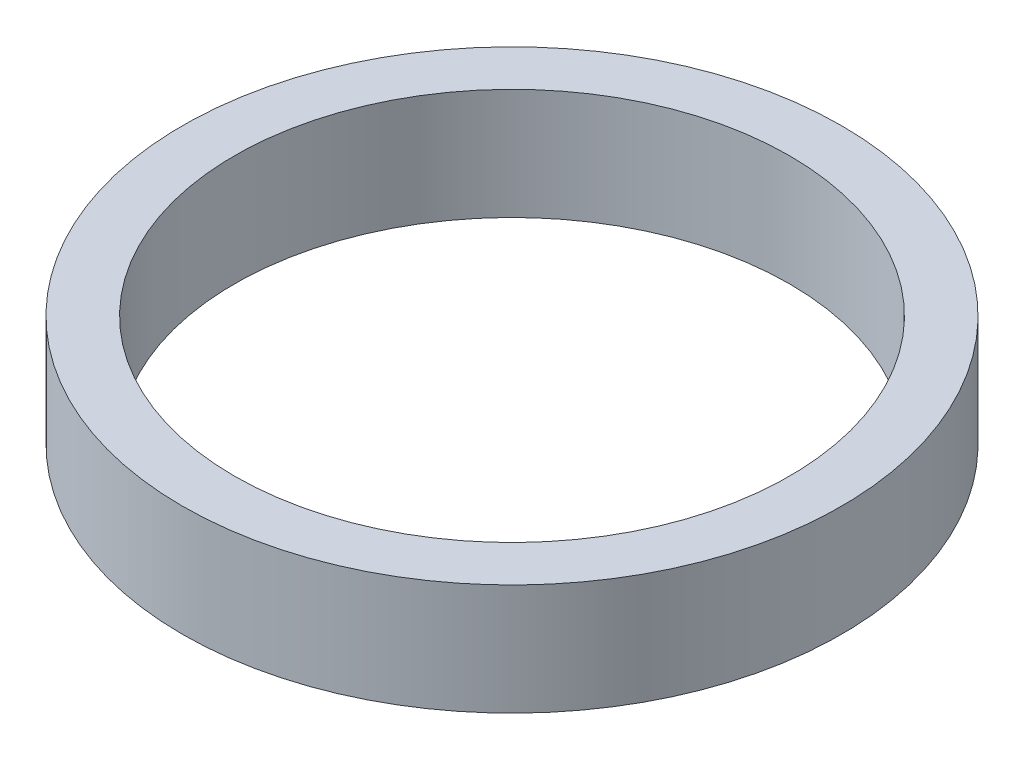
from build123d import *

# Parameters (mm, degrees)
SKETCH1_R           = 47.5
BOSS_EXTRUDE1_DEPTH = 16
SKETCH2_R           = 40
CUT_EXTRUDE1_DEPTH  = 70.054326439


with BuildPart() as part:
    # Sketch1 → Boss-Extrude1 (new body)
    with BuildSketch(Plane(origin=(0, 0, 0), x_dir=(1, 0, 0), z_dir=(0, 1, 0))):
        Circle(SKETCH1_R)
    extrude(amount=BOSS_EXTRUDE1_DEPTH)

    # Sketch2 → Cut-Extrude1 (cut, through all)
    with BuildSketch(Plane(origin=(0, 0, 0), x_dir=(1, 0, 0), z_dir=(0, 1, 0))):
        Circle(SKETCH2_R)
    extrude(amount=CUT_EXTRUDE1_DEPTH, mode=Mode.SUBTRACT)


solid = part.part
